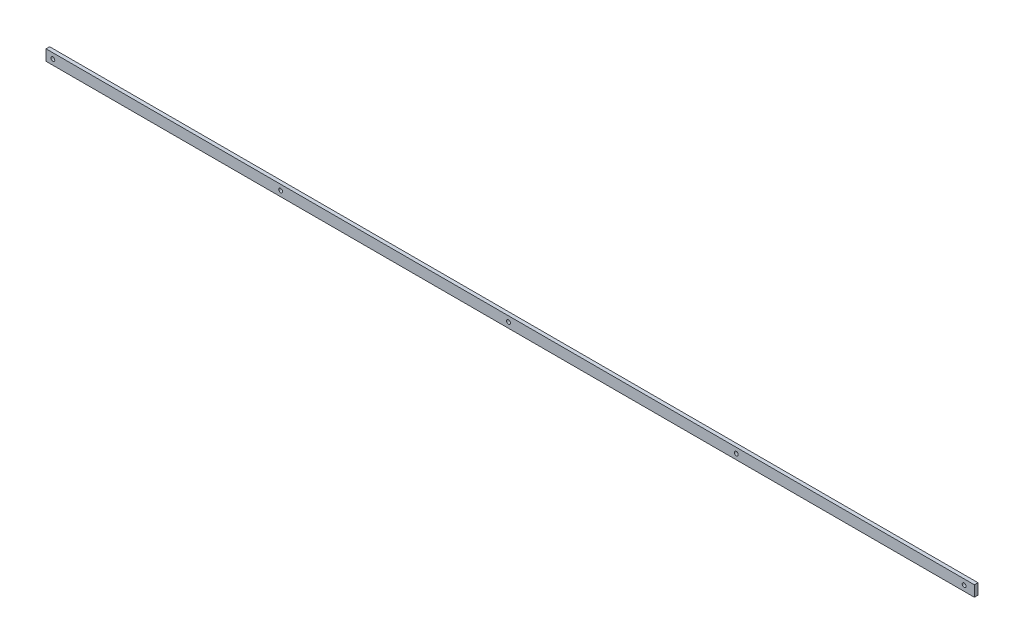
from build123d import *

# Parameters (mm, degrees)
CROQUIS1_W                    = 1630
CROQUIS1_H                    = 19.05
BRIDA_BASE1_DEPTH             = 6.35
TALADRO_DE_MARGEN_PARA_1_41_D = 6.7564


# Sheet-metal steps are written as plain solids
with BuildPart() as part:
    # Croquis1 → Brida base1 (new body)
    with BuildSketch(Plane.XY):
        with Locations((721.097089126, -13.478773585)):
            Rectangle(CROQUIS1_W, CROQUIS1_H)
    extrude(amount=BRIDA_BASE1_DEPTH)

    # Taladro de margen para 1/41 (through all)
    with Locations(Plane.XY.offset(6.35)):
        with Locations((-81.902910874, -13.478773585), (318.097089126, -13.478773585), (718.097089126, -13.478773585), (1118.097089126, -13.478773585), (1518.097089126, -13.478773585)):
            Hole(TALADRO_DE_MARGEN_PARA_1_41_D / 2)


solid = part.part
